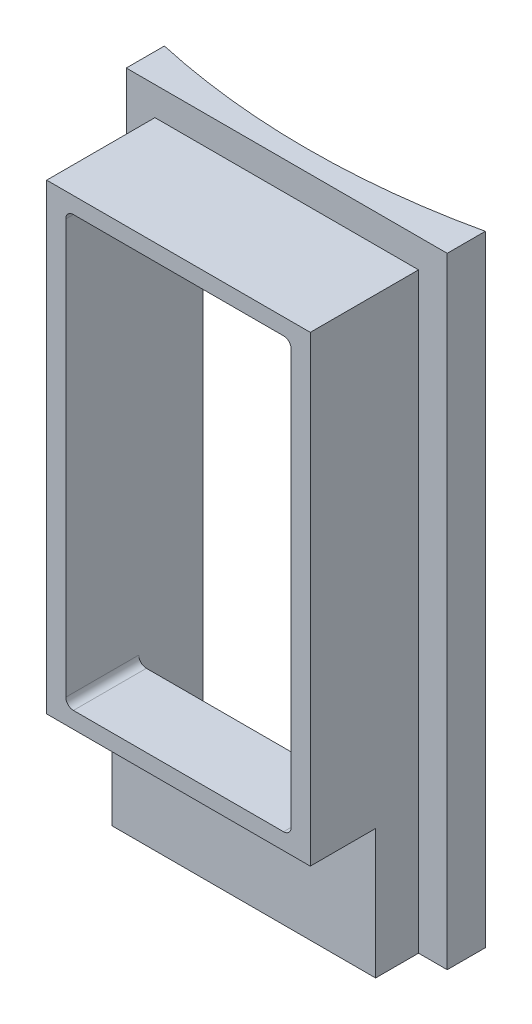
from build123d import *

# Parameters (mm, degrees)
SKETCH1_W           = 106.68
SKETCH1_H           = 206.248
EXTRUDE1_DEPTH      = 252.4252
SKETCH7_W           = 87.63
SKETCH7_H           = 196.723
EXTRUDE5_DEPTH      = 35.98418
EXTRUDE2_DEPTH      = 42.08
EXTRUDE2_DEPTH_BACK = 273.8502
SKETCH4_W           = 74.93
SKETCH4_H           = 142.748
SKETCH10_W          = 74.93
SKETCH10_H          = 2.921
SKETCH10_H_2        = 45.974
EXTRUDE8_DEPTH      = 264.16
SKETCH11_W          = 74.93
SKETCH11_H          = 2.921
EXTRUDE9_DEPTH      = 21.59
FILLET1_R           = 2.54
SKETCH2_R           = 245.618
EXTRUDE4_DEPTH      = 230
SKETCH12_W          = 87.63
SKETCH12_H          = 43.053
EXTRUDE10_DEPTH     = 21.70938


with BuildPart() as part:
    # Sketch1 → Extrude1 (new body)
    with BuildSketch(Plane.XY):
        with Locations((6.35, -16.764)):
            Rectangle(SKETCH1_W, SKETCH1_H)
    extrude(amount=EXTRUDE1_DEPTH)

    # Sketch7 → Extrude5 (add)
    with BuildSketch(Plane.XY.offset(252.4252)):
        with Locations((6.35, -21.5265)):
            Rectangle(SKETCH7_W, SKETCH7_H)
    extrude(amount=EXTRUDE5_DEPTH)

    # Sketch4 → Extrude2 (cut, two sides: drawn at the far end of the back side and taken through both)
    with BuildSketch(Plane.XY.offset(252.4252).offset(-EXTRUDE2_DEPTH_BACK)):
        with Locations((6.35, 0)):
            Rectangle(SKETCH4_W, SKETCH4_H)
    extrude(amount=EXTRUDE2_DEPTH + EXTRUDE2_DEPTH_BACK, mode=Mode.SUBTRACT)

    # Sketch10 → Extrude8 (cut)
    with BuildSketch(Plane(origin=(0, 0, 0), x_dir=(-1, 0, 0), z_dir=(0, 0, -1))):
        with Locations((-6.35, 72.8345)):
            Rectangle(SKETCH10_W, SKETCH10_H)
        with Locations((-6.35, -94.361)):
            Rectangle(SKETCH10_W, SKETCH10_H_2)
    extrude(amount=-EXTRUDE8_DEPTH, mode=Mode.SUBTRACT)

    # Sketch11 → Extrude9 (cut)
    with BuildSketch(Plane(origin=(0, 0, 264.16), x_dir=(-1, 0, 0), z_dir=(0, 0, -1))):
        with Locations((-6.35, 72.8345)):
            Rectangle(SKETCH11_W, SKETCH11_H)
    extrude(amount=-EXTRUDE9_DEPTH, mode=Mode.SUBTRACT)

    # Fillet1
    fillet1_edges = [part.edges().sort_by_distance(p)[0] for p in [
        (43.815, -71.374, 276.28469),
        (-31.115, -71.374, 276.28469),
        (43.815, 71.374, 287.07969),
        (-31.115, 71.374, 287.07969),
        (43.815, -117.348, 132.08),
        (-31.115, -117.348, 132.08),
        (-31.115, 74.295, 142.875),
        (43.815, 74.295, 142.875),
    ]]
    fillet(fillet1_edges, radius=FILLET1_R)

    # Sketch2 → Extrude4 (cut)
    with BuildSketch(Plane(origin=(0, 86.36, 0), x_dir=(-1, 0, 0), z_dir=(0, 1, 0))):
        with Locations((-6.35, 0)):
            Circle(SKETCH2_R)
    extrude(amount=-EXTRUDE4_DEPTH, mode=Mode.SUBTRACT)

    # Sketch12 → Extrude10 (cut)
    with BuildSketch(Plane.XY.offset(288.40938)):
        with Locations((6.35, -98.3615)):
            Rectangle(SKETCH12_W, SKETCH12_H)
    extrude(amount=-EXTRUDE10_DEPTH, mode=Mode.SUBTRACT)


solid = part.part
